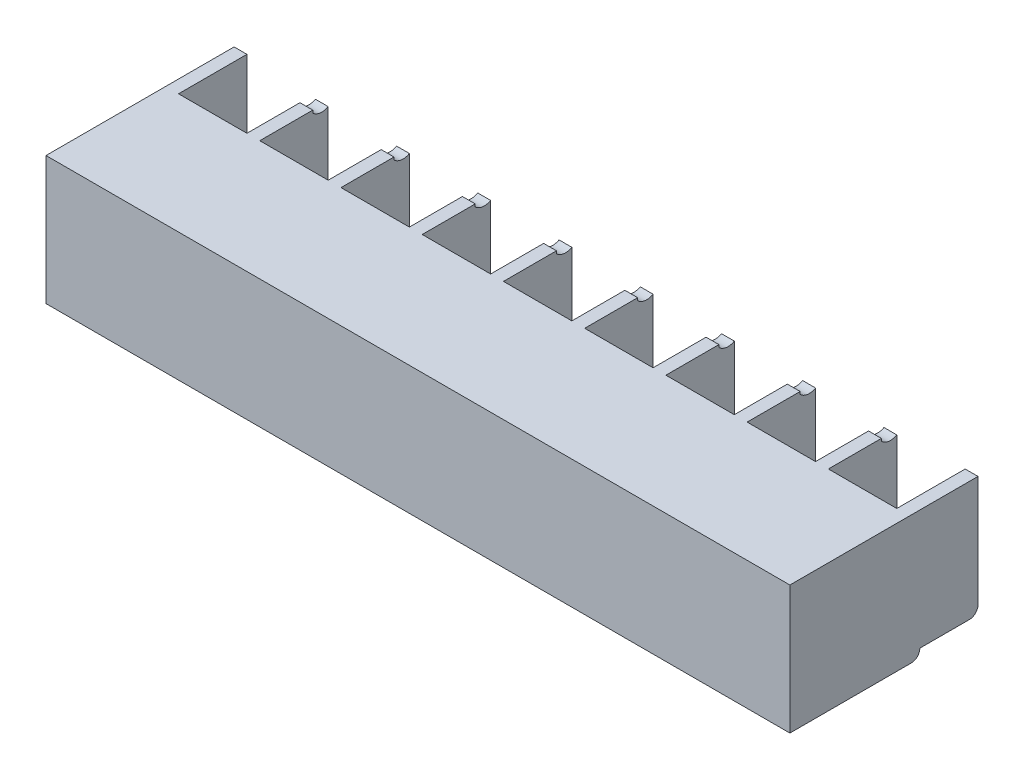
from build123d import *

# Parameters (mm, degrees)
SKETCH_1_W             = 87
SKETCH_1_H             = 15
EXTRUDE_1_DEPTH        = 22
SKETCH_2_W             = 8
SKETCH_2_H             = 15
CUT_EXTRUDE_1_DEPTH    = 8
SKETCH_3_W             = 8
SKETCH_3_H             = 12.5
CUT_EXTRUDE_2_DEPTH    = 1
SKETCH_4_W             = 1.5
SKETCH_4_H             = 6.8
CUT_EXTRUDE_3_DEPTH    = 1
FILLET_1_R             = 1
SKETCH_5_W             = 7.25
SKETCH_5_H             = 12
EXTRUDE_2_DEPTH        = 2
FILLET_2_R             = 2
PATTERN_LINEAR_1_COUNT = 9
PATTERN_LINEAR_1_PITCH = 9.5
FILLET_3_R             = 1
FILLET_4_R             = 2
CUT_EXTRUDE_4_DEPTH    = 36


with BuildPart() as part:
    # Эскиз1 → Бобышка-Вытянуть1 (new body)
    with BuildSketch(Plane.XY):
        Rectangle(SKETCH_1_W, SKETCH_1_H)
    extrude(amount=EXTRUDE_1_DEPTH)

    # Эскиз2 → Вырез-Вытянуть1 (cut)
    with BuildSketch(Plane(origin=(0, 0, 0), x_dir=(-1, 0, 0), z_dir=(0, 0, -1))):
        with Locations((-38, 0)):
            Rectangle(SKETCH_2_W, SKETCH_2_H)
        with Locations((-28.5, 0)):
            Rectangle(SKETCH_2_W, SKETCH_2_H)
        with Locations((-19, 0)):
            Rectangle(SKETCH_2_W, SKETCH_2_H)
        with Locations((-9.5, 0)):
            Rectangle(SKETCH_2_W, SKETCH_2_H)
        Rectangle(SKETCH_2_W, SKETCH_2_H)
        with Locations((9.5, 0)):
            Rectangle(SKETCH_2_W, SKETCH_2_H)
        with Locations((19, 0)):
            Rectangle(SKETCH_2_W, SKETCH_2_H)
        with Locations((28.5, 0)):
            Rectangle(SKETCH_2_W, SKETCH_2_H)
        with Locations((38, 0)):
            Rectangle(SKETCH_2_W, SKETCH_2_H)
    extrude(amount=-CUT_EXTRUDE_1_DEPTH, mode=Mode.SUBTRACT)

    # Эскиз3 → Вырез-Вытянуть2 (cut)
    with BuildSketch(Plane.XZ.offset(7.5)):
        with Locations((-38, 14.25)):
            Rectangle(SKETCH_3_W, SKETCH_3_H)
        with Locations((-28.5, 14.25)):
            Rectangle(SKETCH_3_W, SKETCH_3_H)
        with Locations((-19, 14.25)):
            Rectangle(SKETCH_3_W, SKETCH_3_H)
        with Locations((-9.5, 14.25)):
            Rectangle(SKETCH_3_W, SKETCH_3_H)
        with Locations((0, 14.25)):
            Rectangle(SKETCH_3_W, SKETCH_3_H)
        with Locations((9.5, 14.25)):
            Rectangle(SKETCH_3_W, SKETCH_3_H)
        with Locations((19, 14.25)):
            Rectangle(SKETCH_3_W, SKETCH_3_H)
        with Locations((28.5, 14.25)):
            Rectangle(SKETCH_3_W, SKETCH_3_H)
        with Locations((38, 14.25)):
            Rectangle(SKETCH_3_W, SKETCH_3_H)
    extrude(amount=-CUT_EXTRUDE_2_DEPTH, mode=Mode.SUBTRACT)

    # Эскиз4 → Вырез-Вытянуть3 (cut)
    with BuildSketch(Plane.XZ.offset(7.5)):
        with Locations((-33.25, 3.4)):
            Rectangle(SKETCH_4_W, SKETCH_4_H)
        with Locations((-23.75, 3.4)):
            Rectangle(SKETCH_4_W, SKETCH_4_H)
        with Locations((-14.25, 3.4)):
            Rectangle(SKETCH_4_W, SKETCH_4_H)
        with Locations((-4.75, 3.4)):
            Rectangle(SKETCH_4_W, SKETCH_4_H)
        with Locations((4.75, 3.4)):
            Rectangle(SKETCH_4_W, SKETCH_4_H)
        with Locations((14.25, 3.4)):
            Rectangle(SKETCH_4_W, SKETCH_4_H)
        with Locations((23.75, 3.4)):
            Rectangle(SKETCH_4_W, SKETCH_4_H)
        with Locations((33.25, 3.4)):
            Rectangle(SKETCH_4_W, SKETCH_4_H)
        with Locations((42.75, 3.4)):
            Rectangle(SKETCH_4_W, SKETCH_4_H)
    extrude(amount=-CUT_EXTRUDE_3_DEPTH, mode=Mode.SUBTRACT)

    # Скругление1
    fillet_1_edges = [part.edges().sort_by_distance(p)[0] for p in [
        (42.75, -7.5, 6.8),
        (33.25, -7.5, 6.8),
        (23.75, -7.5, 6.8),
        (14.25, -7.5, 6.8),
        (4.75, -7.5, 6.8),
        (-4.75, -7.5, 6.8),
        (-14.25, -7.5, 6.8),
        (-23.75, -7.5, 6.8),
        (-33.25, -7.5, 6.8),
    ]]
    fillet(fillet_1_edges, radius=FILLET_1_R - 0.0001)  # a hair under: the kernel refuses the full size

    # Эскиз5 → Бобышка-Вытянуть2 (add)
    with BuildSketch(Plane(origin=(0, 0, 8), x_dir=(-1, 0, 0), z_dir=(0, 0, -1))):
        with Locations((-28.5, 0.5)):
            Rectangle(SKETCH_5_W, SKETCH_5_H)
        with Locations((-38, 0.5)):
            Rectangle(SKETCH_5_W, SKETCH_5_H)
        with Locations((-19, 0.5)):
            Rectangle(SKETCH_5_W, SKETCH_5_H)
        with Locations((-9.5, 0.5)):
            Rectangle(SKETCH_5_W, SKETCH_5_H)
        with Locations((0, 0.5)):
            Rectangle(SKETCH_5_W, SKETCH_5_H)
        with Locations((9.5, 0.5)):
            Rectangle(SKETCH_5_W, SKETCH_5_H)
        with Locations((19, 0.5)):
            Rectangle(SKETCH_5_W, SKETCH_5_H)
        with Locations((28.5, 0.5)):
            Rectangle(SKETCH_5_W, SKETCH_5_H)
        with Locations((38, 0.5)):
            Rectangle(SKETCH_5_W, SKETCH_5_H)
    extrude(amount=EXTRUDE_2_DEPTH)

    # Скругление2
    fillet_2_edges = [part.edges().sort_by_distance(p)[0] for p in [
        (38, 6.5, 6),
        (38, -5.5, 6),
        (28.5, 6.5, 6),
        (28.5, -5.5, 6),
        (19, 6.5, 6),
        (9.5, -5.5, 6),
        (19, -5.5, 6),
        (9.5, 6.5, 6),
        (0, 6.5, 6),
        (0, -5.5, 6),
        (-9.5, 6.5, 6),
        (-9.5, -5.5, 6),
        (-19, 6.5, 6),
        (-19, -5.5, 6),
        (-28.5, 6.5, 6),
        (-38, 6.5, 6),
        (-28.5, -5.5, 6),
        (-38, -5.5, 6),
    ]]
    fillet(fillet_2_edges, radius=FILLET_2_R - 0.0001)  # a hair under: the kernel refuses the full size

    # Эскиз6 → Отверстие обработанное метчиком M31 (revolve, cut)
    with BuildSketch(Plane(origin=(-38, 0, 6), x_dir=(0, 1, 0), z_dir=(1, 0, 0))):
        Polygon((0, 0), (0, 6.251075774), (1.25, 5.5), (1.25, 0), align=None)
    hole_wizard_m31 = revolve(axis=Axis((-38, 0, -0.35), (0, 0, 1)), mode=Mode.SUBTRACT)

    # Линейный массив1: Отверстие обработанное метчиком M31 ×9
    with Locations(*[(i * PATTERN_LINEAR_1_PITCH, 0, 0) for i in range(1, PATTERN_LINEAR_1_COUNT)]):
        add(hole_wizard_m31, mode=Mode.SUBTRACT)

    # Скругление3
    fillet_3_edges = [part.edges().sort_by_distance(p)[0] for p in [
        (42.75, -6.5, 0),
        (-42.75, -7.5, 0),
    ]]
    fillet(fillet_3_edges, radius=FILLET_3_R)

    # Скругление4
    fillet_4_edges = [part.edges().sort_by_distance(p)[0] for p in [
        (-33.25, -6.5, 0),
        (-23.75, -6.5, 0),
        (-14.25, -6.5, 0),
        (-4.75, -6.5, 0),
        (4.75, -6.5, 0),
        (14.25, -6.5, 0),
        (23.75, -6.5, 0),
        (33.25, -6.5, 0),
    ]]
    fillet(fillet_4_edges, radius=FILLET_4_R)

    # Эскиз8 → Вырез-Вытянуть4 (cut, symmetric)
    with BuildSketch(Plane(origin=(0, 0, 0), x_dir=(0, 0, -1), z_dir=(1, 0, 0))):
        with BuildLine():
            Line((-1.8, 7.5), (0.321320344, 7.5))
            Line((0.321320344, 7.5), (0.321320344, 7.2))
            ThreePointArc((0.321320344, 7.2), (-0.739339828, 6.760660172), (-1.8, 7.2))
            Line((-1.8, 7.2), (-1.8, 7.5))
        make_face()
    extrude(amount=CUT_EXTRUDE_4_DEPTH, both=True, mode=Mode.SUBTRACT)


solid = part.part
